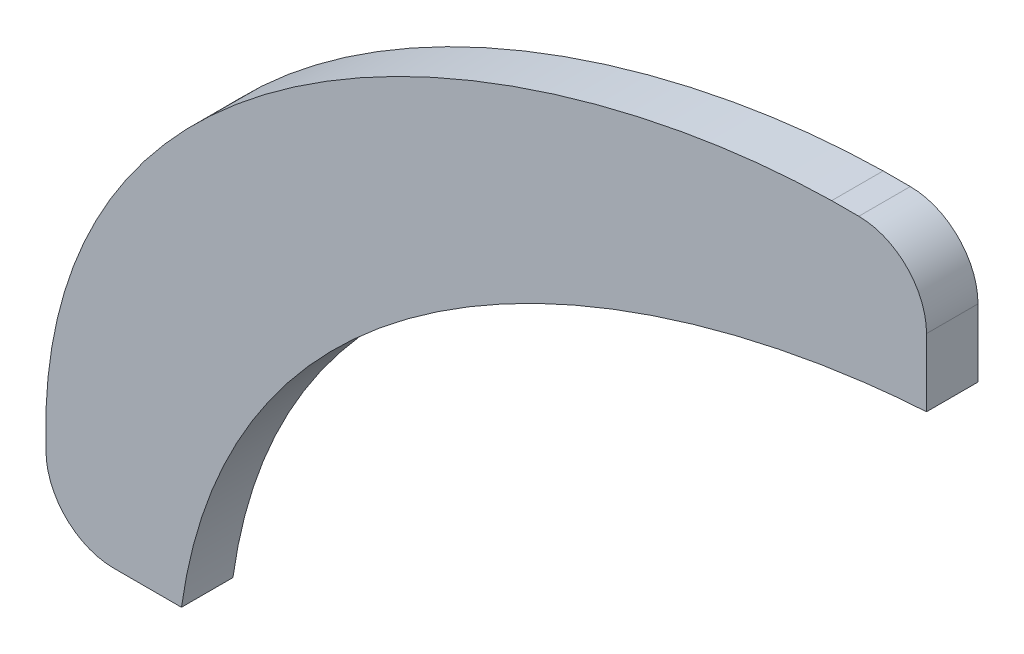
from build123d import *

# Parameters (mm, degrees)
BOSS_EXTRUDE1_DEPTH = 4.826


with BuildPart() as part:
    # Sketch1 → Boss-Extrude1 (new body)
    with BuildSketch(Plane.XY):
        with BuildLine():
            ThreePointArc((0, 6.35), (1.859871939, 1.859871939), (6.35, 0))
            Line((6.35, 0), (12.7, 0))
            add(Edge.make_bspline(
                [(12.7, 0), (17.263490099, 32.946390999), (53.333433175, 49.033191713), (82.55, 50.8)],
                knots=[0, 0, 0, 0, 1, 1, 1, 1], degree=3))
            Line((82.55, 50.8), (82.55, 57.15))
            ThreePointArc((82.55, 57.15), (80.690128061, 61.640128061), (76.2, 63.5))
            Line((76.2, 63.5), (73.660464329, 63.5))
            add(Edge.make_bspline(
                [(0, 9.728566654), (1.333982387, 44.213527708), (43.545631304, 62.980228308), (73.660464329, 63.5)],
                knots=[0.030346022, 0.030346022, 0.030346022, 0.030346022, 0.973178261, 0.973178261, 0.973178261, 0.973178261], degree=3))
            Line((0, 9.728566654), (0, 6.35))
        make_face()
    extrude(amount=BOSS_EXTRUDE1_DEPTH)


solid = part.part
